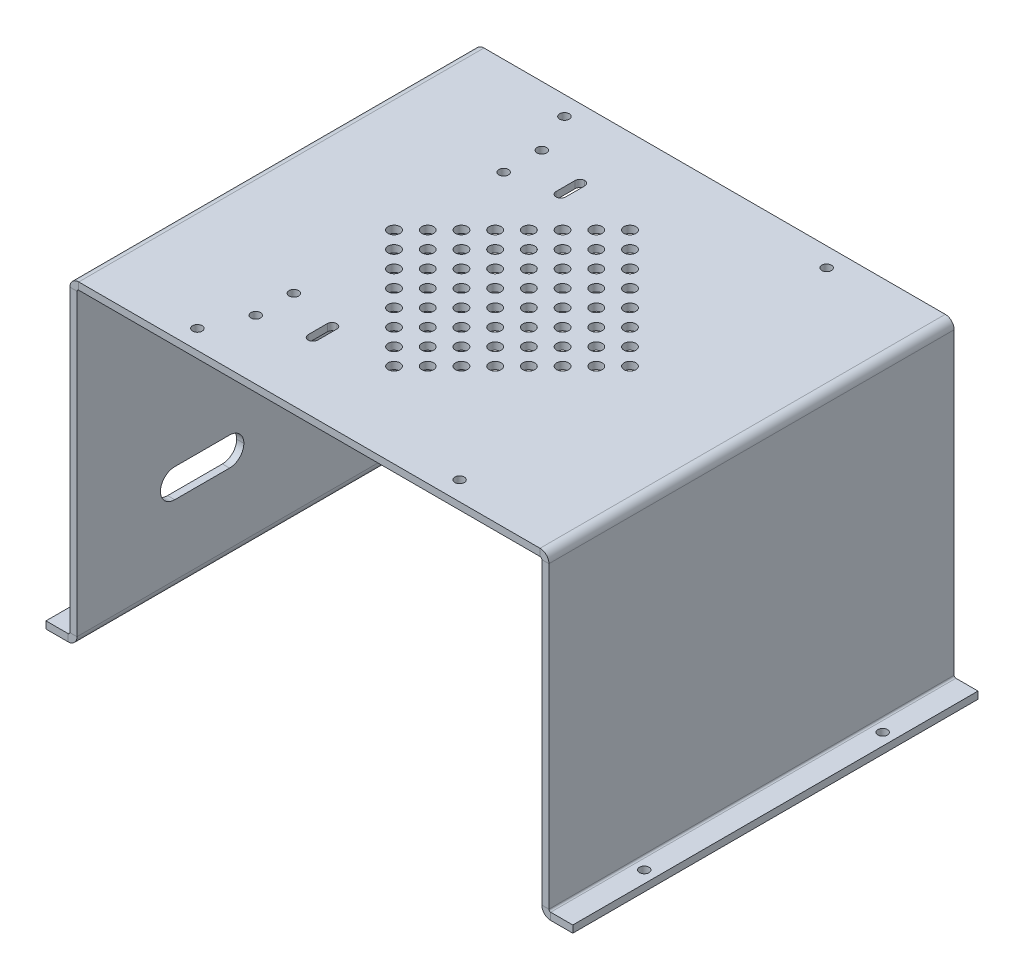
from build123d import *

# Parameters (mm, degrees)
SKETCH_1_W                       = 195
SKETCH_1_H                       = 170
SM_BASE_FLANGE_1_DEPTH           = 3
SKETCH_6_R                       = 2
SKETCH_6_R_2                     = 2.5
SKETCH_6_W                       = 4
SKETCH_6_H                       = 12
CUT_EXTRUDE_1_DEPTH              = 3
SM_EDGE_FLANGE_1_STRIP_W         = 13.4732
SM_EDGE_FLANGE_1_STRIP_H         = 3
SM_EDGE_FLANGE_1_STRIP_CUT_DEPTH = 170
SM_EDGE_FLANGE_1_DEPTH           = 170
SM_EDGE_FLANGE_2_STRIP_W         = 13.4732
SM_EDGE_FLANGE_2_STRIP_H         = 3
SM_EDGE_FLANGE_2_STRIP_CUT_DEPTH = 170
SM_EDGE_FLANGE_2_DEPTH           = 170
CUT_EXTRUDE_2_REACH              = 194.677
SKETCH_13_R                      = 2
CUT_EXTRUDE_3_REACH              = 265.505
SKETCH_14_W                      = 35
SKETCH_14_H                      = 12
FILLET_1_R                       = 6
FILLET_2_R                       = 2


# Sheet-metal steps are written as plain solids
with BuildPart() as part:
    # Sketch 1 → 基体-法兰1 (new body)
    with BuildSketch(Plane(origin=(0, 0, 0), x_dir=(1, 0, 0), z_dir=(0, 1, 0))):
        Rectangle(SKETCH_1_W, SKETCH_1_H)
    extrude(amount=-SM_BASE_FLANGE_1_DEPTH)

    # 草图6 → 切除-拉伸1 (cut)
    with BuildSketch(Plane(origin=(0, 0, 0), x_dir=(1, 0, 0), z_dir=(0, 1, 0))):
        with Locations(Location((-55, -77, 0), (0, 0, 270))):
            Circle(SKETCH_6_R)
        with Locations(Location((55, -77, 0), (0, 0, 270))):
            Circle(SKETCH_6_R)
        with Locations(Location((55, 77, 0), (0, 0, 270))):
            Circle(SKETCH_6_R)
        with Locations(Location((-55, 77, 0), (0, 0, 270))):
            Circle(SKETCH_6_R)
        with Locations(Location((-47.5, 60, 0), (0, 0, 270))):
            Circle(SKETCH_6_R)
        with Locations(Location((-47.5, 44, 0), (0, 0, 270))):
            Circle(SKETCH_6_R)
        with Locations(Location((-47.5, -44, 0), (0, 0, 270))):
            Circle(SKETCH_6_R)
        with Locations(Location((-47.5, -60, 0), (0, 0, 270))):
            Circle(SKETCH_6_R)
        with Locations(Location((0, 49.497474683, 0), (0, 0, 270))):
            Circle(SKETCH_6_R_2)
        with Locations(Location((-7.071067812, 42.426406871, 0), (0, 0, 270))):
            Circle(SKETCH_6_R_2)
        with Locations(Location((-14.142135624, 35.355339059, 0), (0, 0, 270))):
            Circle(SKETCH_6_R_2)
        with Locations(Location((-21.213203436, 28.284271247, 0), (0, 0, 270))):
            Circle(SKETCH_6_R_2)
        with Locations(Location((-28.284271247, 21.213203436, 0), (0, 0, 270))):
            Circle(SKETCH_6_R_2)
        with Locations(Location((-35.355339059, 14.142135624, 0), (0, 0, 270))):
            Circle(SKETCH_6_R_2)
        with Locations(Location((-42.426406871, 7.071067812, 0), (0, 0, 270))):
            Circle(SKETCH_6_R_2)
        with Locations(Location((-49.497474683, 0, 0), (0, 0, 270))):
            Circle(SKETCH_6_R_2)
        with Locations(Location((0, 35.355339059, 0), (0, 0, 270))):
            Circle(SKETCH_6_R_2)
        with Locations(Location((-7.071067812, 28.284271247, 0), (0, 0, 270))):
            Circle(SKETCH_6_R_2)
        with Locations(Location((-14.142135624, 21.213203436, 0), (0, 0, 270))):
            Circle(SKETCH_6_R_2)
        with Locations(Location((-21.213203436, 14.142135624, 0), (0, 0, 270))):
            Circle(SKETCH_6_R_2)
        with Locations(Location((-28.284271247, 7.071067812, 0), (0, 0, 270))):
            Circle(SKETCH_6_R_2)
        with Locations(Location((-35.355339059, 0, 0), (0, 0, 270))):
            Circle(SKETCH_6_R_2)
        with Locations(Location((-42.426406871, -7.071067812, 0), (0, 0, 270))):
            Circle(SKETCH_6_R_2)
        with Locations(Location((7.071067812, 28.284271247, 0), (0, 0, 270))):
            Circle(SKETCH_6_R_2)
        with Locations(Location((0, 21.213203436, 0), (0, 0, 270))):
            Circle(SKETCH_6_R_2)
        with Locations(Location((-7.071067812, 14.142135624, 0), (0, 0, 270))):
            Circle(SKETCH_6_R_2)
        with Locations(Location((-14.142135624, 7.071067812, 0), (0, 0, 270))):
            Circle(SKETCH_6_R_2)
        with Locations(Location((-21.213203436, 0, 0), (0, 0, 270))):
            Circle(SKETCH_6_R_2)
        with Locations(Location((-28.284271247, -7.071067812, 0), (0, 0, 270))):
            Circle(SKETCH_6_R_2)
        with Locations(Location((-35.355339059, -14.142135624, 0), (0, 0, 270))):
            Circle(SKETCH_6_R_2)
        with Locations(Location((14.142135624, 21.213203436, 0), (0, 0, 270))):
            Circle(SKETCH_6_R_2)
        with Locations(Location((7.071067812, 14.142135624, 0), (0, 0, 270))):
            Circle(SKETCH_6_R_2)
        with Locations(Location((0, 7.071067812, 0), (0, 0, 270))):
            Circle(SKETCH_6_R_2)
        with Locations(Location((-7.071067812, 0, 0), (0, 0, 270))):
            Circle(SKETCH_6_R_2)
        with Locations(Location((-14.142135624, -7.071067812, 0), (0, 0, 270))):
            Circle(SKETCH_6_R_2)
        with Locations(Location((-21.213203436, -14.142135624, 0), (0, 0, 270))):
            Circle(SKETCH_6_R_2)
        with Locations(Location((-28.284271247, -21.213203436, 0), (0, 0, 270))):
            Circle(SKETCH_6_R_2)
        with Locations(Location((21.213203436, 14.142135624, 0), (0, 0, 270))):
            Circle(SKETCH_6_R_2)
        with Locations(Location((14.142135624, 7.071067812, 0), (0, 0, 270))):
            Circle(SKETCH_6_R_2)
        with Locations(Location((7.071067812, 0, 0), (0, 0, 270))):
            Circle(SKETCH_6_R_2)
        with Locations(Location((0, -7.071067812, 0), (0, 0, 270))):
            Circle(SKETCH_6_R_2)
        with Locations(Location((-7.071067812, -14.142135624, 0), (0, 0, 270))):
            Circle(SKETCH_6_R_2)
        with Locations(Location((-14.142135624, -21.213203436, 0), (0, 0, 270))):
            Circle(SKETCH_6_R_2)
        with Locations(Location((-21.213203436, -28.284271247, 0), (0, 0, 270))):
            Circle(SKETCH_6_R_2)
        with Locations(Location((28.284271247, 7.071067812, 0), (0, 0, 270))):
            Circle(SKETCH_6_R_2)
        with Locations(Location((21.213203436, 0, 0), (0, 0, 270))):
            Circle(SKETCH_6_R_2)
        with Locations(Location((14.142135624, -7.071067812, 0), (0, 0, 270))):
            Circle(SKETCH_6_R_2)
        with Locations(Location((7.071067812, -14.142135624, 0), (0, 0, 270))):
            Circle(SKETCH_6_R_2)
        with Locations(Location((0, -21.213203436, 0), (0, 0, 270))):
            Circle(SKETCH_6_R_2)
        with Locations(Location((-7.071067812, -28.284271247, 0), (0, 0, 270))):
            Circle(SKETCH_6_R_2)
        with Locations(Location((-14.142135624, -35.355339059, 0), (0, 0, 270))):
            Circle(SKETCH_6_R_2)
        with Locations(Location((35.355339059, 0, 0), (0, 0, 270))):
            Circle(SKETCH_6_R_2)
        with Locations(Location((28.284271247, -7.071067812, 0), (0, 0, 270))):
            Circle(SKETCH_6_R_2)
        with Locations(Location((21.213203436, -14.142135624, 0), (0, 0, 270))):
            Circle(SKETCH_6_R_2)
        with Locations(Location((14.142135624, -21.213203436, 0), (0, 0, 270))):
            Circle(SKETCH_6_R_2)
        with Locations(Location((7.071067812, -28.284271247, 0), (0, 0, 270))):
            Circle(SKETCH_6_R_2)
        with Locations(Location((0, -35.355339059, 0), (0, 0, 270))):
            Circle(SKETCH_6_R_2)
        with Locations(Location((-7.071067812, -42.426406871, 0), (0, 0, 270))):
            Circle(SKETCH_6_R_2)
        with Locations(Location((42.426406871, -7.071067812, 0), (0, 0, 270))):
            Circle(SKETCH_6_R_2)
        with Locations(Location((35.355339059, -14.142135624, 0), (0, 0, 270))):
            Circle(SKETCH_6_R_2)
        with Locations(Location((28.284271247, -21.213203436, 0), (0, 0, 270))):
            Circle(SKETCH_6_R_2)
        with Locations(Location((21.213203436, -28.284271247, 0), (0, 0, 270))):
            Circle(SKETCH_6_R_2)
        with Locations(Location((14.142135624, -35.355339059, 0), (0, 0, 270))):
            Circle(SKETCH_6_R_2)
        with Locations(Location((7.071067812, -42.426406871, 0), (0, 0, 270))):
            Circle(SKETCH_6_R_2)
        with Locations(Location((0, -49.497474683, 0), (0, 0, 270))):
            Circle(SKETCH_6_R_2)
        with Locations(Location((7.071067812, 42.426406871, 0), (0, 0, 270))):
            Circle(SKETCH_6_R_2)
        with Locations(Location((14.142135624, 35.355339059, 0), (0, 0, 270))):
            Circle(SKETCH_6_R_2)
        with Locations(Location((21.213203436, 28.284271247, 0), (0, 0, 270))):
            Circle(SKETCH_6_R_2)
        with Locations(Location((28.284271247, 21.213203436, 0), (0, 0, 270))):
            Circle(SKETCH_6_R_2)
        with Locations(Location((35.355339059, 14.142135624, 0), (0, 0, 270))):
            Circle(SKETCH_6_R_2)
        with Locations(Location((42.426406871, 7.071067812, 0), (0, 0, 270))):
            Circle(SKETCH_6_R_2)
        with Locations(Location((49.497474683, 0, 0), (0, 0, 270))):
            Circle(SKETCH_6_R_2)
        with Locations((-27.5, -52)):
            Rectangle(SKETCH_6_W, SKETCH_6_H)
        with Locations((-27.5, 52)):
            Rectangle(SKETCH_6_W, SKETCH_6_H)
    extrude(amount=-CUT_EXTRUDE_1_DEPTH, mode=Mode.SUBTRACT)

    # 边线-法兰1 strip (across the edge) → 边线-法兰1 strip cut (cut)
    with BuildSketch(Plane(origin=(-97.5, -3, 85), x_dir=(1, 0, 0), z_dir=(0, 0, -1))):
        with Locations((-6, -1.5)):
            Rectangle(SM_EDGE_FLANGE_1_STRIP_W, SM_EDGE_FLANGE_1_STRIP_H)
    sm_edge_flange_1_strip_cut = extrude(amount=SM_EDGE_FLANGE_1_STRIP_CUT_DEPTH, mode=Mode.SUBTRACT)

    # 边线-法兰1 section (across the edge) → 边线-法兰1 (add)
    with BuildSketch(Plane(origin=(-97.5, -3, 85), x_dir=(1, 0, 0), z_dir=(0, 0, -1))):
        with BuildLine():
            Line((-3, 0.7366), (-3, 130))
            Line((-3, 130), (0, 130))
            Line((0, 130), (0, 0.7366))
            ThreePointArc((0, 0.7366), (0.215745145, 0.215745145), (0.7366, 0))
            Line((0.7366, 0), (0.7366, -3))
            ThreePointArc((0.7366, -3), (-1.905575199, -1.905575199), (-3, 0.7366))
        make_face()
    sm_edge_flange_1 = extrude(amount=SM_EDGE_FLANGE_1_DEPTH)

    # 边线-法兰2 strip (across the edge) → 边线-法兰2 strip cut (cut)
    with BuildSketch(Plane(origin=(-100.5, -133, -85), x_dir=(0, 1, 0), z_dir=(0, 0, 1))):
        with Locations((-3, -1.5)):
            Rectangle(SM_EDGE_FLANGE_2_STRIP_W, SM_EDGE_FLANGE_2_STRIP_H)
    sm_edge_flange_2_strip_cut = extrude(amount=SM_EDGE_FLANGE_2_STRIP_CUT_DEPTH, mode=Mode.SUBTRACT)

    # 边线-法兰2 section (across the edge) → 边线-法兰2 (add)
    with BuildSketch(Plane(origin=(-100.5, -133, -85), x_dir=(0, 1, 0), z_dir=(0, 0, 1))):
        with BuildLine():
            Line((0, 0.7366), (0, 10))
            Line((0, 10), (3, 10))
            Line((3, 10), (3, 0.7366))
            ThreePointArc((3, 0.7366), (3.215745145, 0.215745145), (3.7366, 0))
            Line((3.7366, 0), (3.7366, -3))
            ThreePointArc((3.7366, -3), (1.094424801, -1.905575199), (0, 0.7366))
        make_face()
    sm_edge_flange_2 = extrude(amount=SM_EDGE_FLANGE_2_DEPTH)

    # 草图13 → 切除-拉伸2 (cut, up to next)
    with BuildSketch(Plane.XZ.offset(133), mode=Mode.PRIVATE) as cut_extrude_2_sk1:
        with Locations(Location((-105.5, 50, 0), (0, 0, 270))):
            Circle(SKETCH_13_R)
    cut_extrude_2_tool1 = extrude(cut_extrude_2_sk1.sketch, amount=-CUT_EXTRUDE_2_REACH, mode=Mode.PRIVATE) & part.part
    # 草图13 → 切除-拉伸2 (cut, up to next)
    with BuildSketch(Plane.XZ.offset(133), mode=Mode.PRIVATE) as cut_extrude_2_sk2:
        with Locations(Location((-105.5, -50, 0), (0, 0, 90))):
            Circle(SKETCH_13_R)
    cut_extrude_2_tool2 = extrude(cut_extrude_2_sk2.sketch, amount=-CUT_EXTRUDE_2_REACH, mode=Mode.PRIVATE) & part.part
    cut_extrude_2_1 = cut_extrude_2_tool1.solids().sort_by_distance((-105.5, -133, 50))[0]
    add(cut_extrude_2_1, mode=Mode.SUBTRACT)
    cut_extrude_2_2 = cut_extrude_2_tool2.solids().sort_by_distance((-105.5, -133, -50))[0]
    add(cut_extrude_2_2, mode=Mode.SUBTRACT)
    cut_extrude_2 = cut_extrude_2_1 + cut_extrude_2_2  # 切除-拉伸2 as one shape, for the pattern or mirror that repeats it

    # 镜向1: 边线-法兰1 strip cut, 边线-法兰1, 边线-法兰2 strip cut, 边线-法兰2, 切除-拉伸2 across plane
    add(sm_edge_flange_1_strip_cut.mirror(Plane(origin=(0, 0, 0), x_dir=(0, 0, 1), z_dir=(1, 0, 0))), mode=Mode.SUBTRACT)
    add(sm_edge_flange_1.mirror(Plane(origin=(0, 0, 0), x_dir=(0, 0, 1), z_dir=(1, 0, 0))))
    add(sm_edge_flange_2_strip_cut.mirror(Plane(origin=(0, 0, 0), x_dir=(0, 0, 1), z_dir=(1, 0, 0))), mode=Mode.SUBTRACT)
    add(sm_edge_flange_2.mirror(Plane(origin=(0, 0, 0), x_dir=(0, 0, 1), z_dir=(1, 0, 0))))
    add(cut_extrude_2.mirror(Plane(origin=(0, 0, 0), x_dir=(0, 0, 1), z_dir=(1, 0, 0))), mode=Mode.SUBTRACT)

    # 草图14 → 切除-拉伸3 (cut, up to next)
    with BuildSketch(Plane.ZY.offset(100.5), mode=Mode.PRIVATE) as cut_extrude_3_sk1:
        with Locations((-32.5, -94)):
            Rectangle(SKETCH_14_W, SKETCH_14_H)
    cut_extrude_3_tool1 = extrude(cut_extrude_3_sk1.sketch, amount=-CUT_EXTRUDE_3_REACH, mode=Mode.PRIVATE) & part.part
    # 草图14 → 切除-拉伸3 (cut, up to next)
    with BuildSketch(Plane.ZY.offset(100.5), mode=Mode.PRIVATE) as cut_extrude_3_sk2:
        with Locations((32.5, -94)):
            Rectangle(SKETCH_14_W, SKETCH_14_H)
    cut_extrude_3_tool2 = extrude(cut_extrude_3_sk2.sketch, amount=-CUT_EXTRUDE_3_REACH, mode=Mode.PRIVATE) & part.part
    add(cut_extrude_3_tool1.solids().sort_by_distance((-100.5, -94, -32.5))[0], mode=Mode.SUBTRACT)
    add(cut_extrude_3_tool2.solids().sort_by_distance((-100.5, -94, 32.5))[0], mode=Mode.SUBTRACT)

    # 圆角1
    fillet_1_edges = [part.edges().sort_by_distance(p)[0] for p in [
        (-99, -100, 50),
        (-99, -88, 50),
        (-99, -88, 15),
        (-99, -100, 15),
        (-99, -88, -15),
        (-99, -100, -15),
        (-99, -100, -50),
        (-99, -88, -50),
    ]]
    fillet(fillet_1_edges, radius=FILLET_1_R - 0.0001)  # a hair under: the kernel refuses the full size

    # 圆角2
    fillet_2_edges = [part.edges().sort_by_distance(p)[0] for p in [
        (-25.5, -1.5, 58),
        (-29.5, -1.5, 58),
        (-29.5, -1.5, 46),
        (-25.5, -1.5, 46),
        (-25.5, -1.5, -58),
        (-25.5, -1.5, -46),
        (-29.5, -1.5, -46),
        (-29.5, -1.5, -58),
    ]]
    fillet(fillet_2_edges, radius=FILLET_2_R - 0.0001)  # a hair under: the kernel refuses the full size


solid = part.part
